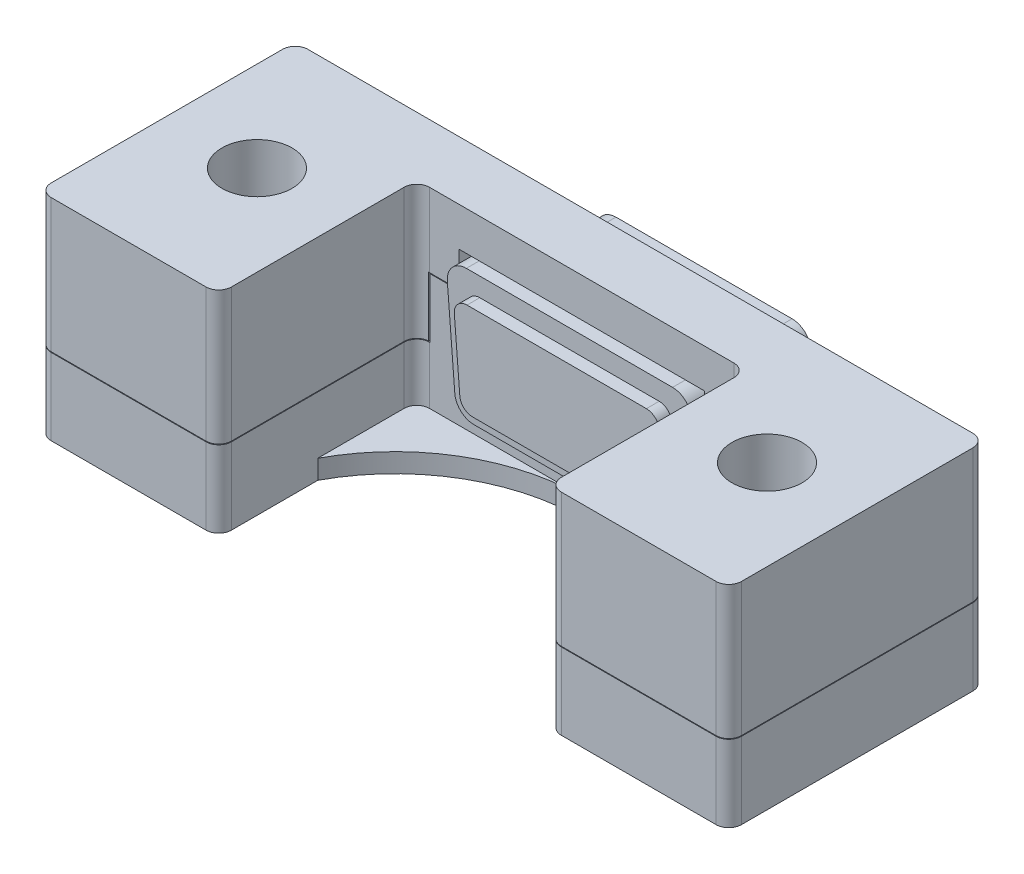
from build123d import *

# Parameters (mm, degrees)
SKETCH1_W               = 30.87
SKETCH1_H               = 12.52
SKETCH1_R               = 1.5
BOSS_EXTRUDE1_DEPTH     = 0.64
BOSS_EXTRUDE2_DEPTH     = 6
BOSS_EXTRUDE3_DEPTH     = 3.91
BOSS_EXTRUDE4_DEPTH     = 1
CUT_EXTRUDE1_DEPTH      = 0.1
BOSS_EXTRUDE5_START     = 0.01
SKETCH5_W               = 34.87
SKETCH5_H               = 16.52
BOSS_EXTRUDE5_DEPTH     = 1
SKETCH6_W               = 34.87
SKETCH6_H               = 16.52
SKETCH6_W_2             = 30.97
SKETCH6_H_2             = 12.62
BOSS_EXTRUDE6_DEPTH     = 1.1
SKETCH7_R               = 1.920228868
SKETCH7_R_2             = 1.5
SKETCH7_R_3             = 1.801647022
BOSS_EXTRUDE7_DEPTH     = 0.44
BOSS_EXTRUDE8_START     = 0.45
SKETCH8_W               = 34.87
SKETCH8_H               = 16.52
SKETCH8_W_2             = 19.27
SKETCH8_H_2             = 10.42
BOSS_EXTRUDE8_DEPTH     = 2.5
SKETCH9_R               = 2.067
BOSS_EXTRUDE10_DEPTH    = 16.52
FILLET1_R               = 1
BOSS_EXTRUDE11_DEPTH    = 1.5
CUT_EXTRUDE2_DEPTH      = 50.220202763
CUT_EXTRUDE2_DEPTH_BACK = 50.220202763
SKETCH11_W              = 7.833
SKETCH11_H              = 0.05
CUT_EXTRUDE3_DEPTH      = 50.447525519
CUT_EXTRUDE3_DEPTH_BACK = 50.447525519
SKETCH12_R              = 2.75
CUT_EXTRUDE4_DEPTH      = 5
CUT_EXTRUDE4_DEPTH_BACK = 50.447525519
CUT_EXTRUDE4_START      = -16.52
SKETCH12_2_R            = 2.75
THREAD1_PITCH           = 0.8
THREAD2_PITCH           = 0.8


with BuildPart() as part:
    # Sketch1 → Boss-Extrude1 (new body)
    # profile 1 of 2: a face of its own
    with BuildSketch(Plane.XY):
        with Locations((15.435, 6.26)):
            Rectangle(SKETCH1_W, SKETCH1_H)
        with Locations(Location((2.92, 6.26, 0), (0, 0, 180))):
            Circle(SKETCH1_R, mode=Mode.SUBTRACT)
        with Locations(Location((27.95, 6.26, 0), (0, 0, 180))):
            Circle(SKETCH1_R, mode=Mode.SUBTRACT)
        with BuildLine():
            ThreePointArc((23.82238222, 8.484029677), (23.478822582, 9.689511938), (22.34, 10.213252174))
            Line((22.34, 10.213252174), (8.53, 10.213252174))
            ThreePointArc((8.53, 10.213252174), (7.391177418, 9.689511938), (7.04761778, 8.484029677))
            Line((7.04761778, 8.484029677), (7.840875681, 3.354029677))
            ThreePointArc((7.840875681, 3.354029677), (8.346998137, 2.444429592), (9.323257901, 2.083252174))
            Line((9.323257901, 2.083252174), (21.546742099, 2.083252174))
            ThreePointArc((21.546742099, 2.083252174), (22.523001863, 2.444429592), (23.029124319, 3.354029677))
            Line((23.029124319, 3.354029677), (23.82238222, 8.484029677))
        make_face(mode=Mode.SUBTRACT)
    # profile 2 of 2: a face of its own
    with BuildSketch(Plane.XY):
        with BuildLine():
            Line((23.029124319, 3.354029677), (23.82238222, 8.484029677))
            ThreePointArc((23.82238222, 8.484029677), (23.478822582, 9.689511938), (22.34, 10.213252174))
            Line((22.34, 10.213252174), (8.53, 10.213252174))
            ThreePointArc((8.53, 10.213252174), (7.391177418, 9.689511938), (7.04761778, 8.484029677))
            Line((7.04761778, 8.484029677), (7.840875681, 3.354029677))
            ThreePointArc((7.840875681, 3.354029677), (8.346998137, 2.444429592), (9.323257901, 2.083252174))
            Line((9.323257901, 2.083252174), (21.546742099, 2.083252174))
            ThreePointArc((21.546742099, 2.083252174), (22.523001863, 2.444429592), (23.029124319, 3.354029677))
        make_face()
    extrude(amount=BOSS_EXTRUDE1_DEPTH)

    # Sketch1<3> → Boss-Extrude2 (add)
    with BuildSketch(Plane.XY):
        with BuildLine():
            Line((23.029124319, 3.354029677), (23.82238222, 8.484029677))
            ThreePointArc((23.82238222, 8.484029677), (23.478822582, 9.689511938), (22.34, 10.213252174))
            Line((22.34, 10.213252174), (8.53, 10.213252174))
            ThreePointArc((8.53, 10.213252174), (7.391177418, 9.689511938), (7.04761778, 8.484029677))
            Line((7.04761778, 8.484029677), (7.840875681, 3.354029677))
            ThreePointArc((7.840875681, 3.354029677), (8.346998137, 2.444429592), (9.323257901, 2.083252174))
            Line((9.323257901, 2.083252174), (21.546742099, 2.083252174))
            ThreePointArc((21.546742099, 2.083252174), (22.523001863, 2.444429592), (23.029124319, 3.354029677))
        make_face()
    extrude(amount=-BOSS_EXTRUDE2_DEPTH)

    # Sketch2 → Boss-Extrude3 (add)
    with BuildSketch(Plane.XY.offset(0.64)):
        with BuildLine():
            Line((22.933471556, 1.1), (7.936528444, 1.1))
            ThreePointArc((7.936528444, 1.1), (6.91910754, 1.497795525), (6.441320613, 2.480193726))
            Line((6.441320613, 2.480193726), (5.854792169, 9.800193726))
            ThreePointArc((5.854792169, 9.800193726), (6.247795525, 10.937420903), (7.35, 11.42))
            Line((7.35, 11.42), (23.52, 11.42))
            ThreePointArc((23.52, 11.42), (24.622204475, 10.937420903), (25.015207831, 9.800193726))
            Line((25.015207831, 9.800193726), (24.428679387, 2.480193726))
            ThreePointArc((24.428679387, 2.480193726), (23.95089246, 1.497795525), (22.933471556, 1.1))
        make_face()
    extrude(amount=BOSS_EXTRUDE3_DEPTH)

    # Sketch3 → Boss-Extrude4 (add)
    with BuildSketch(Plane.XY.offset(4.55)):
        with BuildLine():
            Line((8.831914281, 2.57), (22.038085719, 2.57))
            ThreePointArc((22.038085719, 2.57), (22.716366322, 2.835197017), (23.03489094, 3.490129151))
            Line((23.03489094, 3.490129151), (23.465973321, 8.870129151))
            ThreePointArc((23.465973321, 8.870129151), (23.203971084, 9.628280602), (22.4691681, 9.95))
            Line((22.4691681, 9.95), (8.4008319, 9.95))
            ThreePointArc((8.4008319, 9.95), (7.666028916, 9.628280602), (7.404026679, 8.870129151))
            Line((7.404026679, 8.870129151), (7.83510906, 3.490129151))
            ThreePointArc((7.83510906, 3.490129151), (8.153633678, 2.835197017), (8.831914281, 2.57))
        make_face()
    extrude(amount=BOSS_EXTRUDE4_DEPTH)

    # Sketch4 → Cut-Extrude1 (cut)
    with BuildSketch(Plane(origin=(0, 0, -6), x_dir=(-1, 0, 0), z_dir=(0, 0, -1))):
        with BuildLine():
            Line((-21.546742099, 2.283252174), (-9.323257901, 2.283252174))
            ThreePointArc((-9.323257901, 2.283252174), (-8.477166105, 2.596272603), (-8.038526644, 3.384592677))
            Line((-8.038526644, 3.384592677), (-7.245268742, 8.514592677))
            ThreePointArc((-7.245268742, 8.514592677), (-7.543020429, 9.55934397), (-8.53, 10.013252174))
            Line((-8.53, 10.013252174), (-22.34, 10.013252174))
            ThreePointArc((-22.34, 10.013252174), (-23.326979571, 9.55934397), (-23.624731258, 8.514592677))
            Line((-23.624731258, 8.514592677), (-22.831473356, 3.384592677))
            ThreePointArc((-22.831473356, 3.384592677), (-22.392833895, 2.596272603), (-21.546742099, 2.283252174))
        make_face()
    extrude(amount=-CUT_EXTRUDE1_DEPTH, mode=Mode.SUBTRACT)

    # Sketch7 → Boss-Extrude7 (add)
    # profile 1 of 2: a face of its own
    with BuildSketch(Plane.XY.offset(0.64)):
        with Locations((2.92, 6.26)):
            Circle(SKETCH7_R)
        with Locations(Location((2.92, 6.26, 0), (0, 0, 180))):
            Circle(SKETCH7_R_2, mode=Mode.SUBTRACT)
    # profile 2 of 2: a face of its own
    with BuildSketch(Plane.XY.offset(0.64)):
        with Locations((27.95, 6.26)):
            Circle(SKETCH7_R_3)
        with Locations(Location((27.95, 6.26, 0), (0, 0, 180))):
            Circle(SKETCH7_R_2, mode=Mode.SUBTRACT)
    extrude(amount=BOSS_EXTRUDE7_DEPTH)


with BuildPart() as body_2:
    # Sketch5 → Boss-Extrude5 (new body)
    with BuildSketch(Plane(origin=(0, 0, 0), x_dir=(-1, 0, 0), z_dir=(0, 0, -1)).offset(BOSS_EXTRUDE5_START)):
        with Locations((-15.435, 6.26)):
            Rectangle(SKETCH5_W, SKETCH5_H)
        with BuildLine():
            Line((-21.546742099, 1.083252174), (-9.323257901, 1.083252174))
            ThreePointArc((-9.323257901, 1.083252174), (-7.696158294, 1.685214538), (-6.852620867, 3.201214679))
            Line((-6.852620867, 3.201214679), (-6.059362966, 8.331214679))
            ThreePointArc((-6.059362966, 8.331214679), (-6.631962364, 10.340351781), (-8.53, 11.213252174))
            Line((-8.53, 11.213252174), (-22.34, 11.213252174))
            ThreePointArc((-22.34, 11.213252174), (-24.238037636, 10.340351781), (-24.810637034, 8.331214679))
            Line((-24.810637034, 8.331214679), (-24.017379133, 3.201214679))
            ThreePointArc((-24.017379133, 3.201214679), (-23.173841706, 1.685214538), (-21.546742099, 1.083252174))
        make_face(mode=Mode.SUBTRACT)
    extrude(amount=BOSS_EXTRUDE5_DEPTH)

    # Sketch6 → Boss-Extrude6 (add)
    with BuildSketch(Plane.XY.offset(-0.01)):
        with Locations((15.435, 6.26)):
            Rectangle(SKETCH6_W, SKETCH6_H)
        with Locations((15.435, 6.26)):
            Rectangle(SKETCH6_W_2, SKETCH6_H_2, mode=Mode.SUBTRACT)
    extrude(amount=BOSS_EXTRUDE6_DEPTH)

    # Sketch8 → Boss-Extrude8 (add)
    with BuildSketch(Plane.XY.offset(0.64).offset(BOSS_EXTRUDE8_START)):
        with Locations((15.435, 6.26)):
            Rectangle(SKETCH8_W, SKETCH8_H)
        with Locations((15.435, 6.26)):
            Rectangle(SKETCH8_W_2, SKETCH8_H_2, mode=Mode.SUBTRACT)
    extrude(amount=BOSS_EXTRUDE8_DEPTH)

    # Sketch9 → Boss-Extrude10 (add)
    # profile 1 of 2: a face of its own
    with BuildSketch(Plane.XZ.offset(2)):
        Polygon((32.87, -1.01), (42.502, -1.01), (42.502, 19.124), (28.368, 19.124), (28.368, 3.59), (32.87, 3.59), align=None)
        with Locations((35.435, 9.057)):
            Circle(SKETCH9_R, mode=Mode.SUBTRACT)
    # profile 2 of 2: a face of its own
    with BuildSketch(Plane.XZ.offset(2)):
        Polygon((-11.632, 19.124), (-11.632, -1.01), (-2, -1.01), (-2, 3.59), (2.502, 3.59), (2.502, 19.124), align=None)
        with Locations((-4.565, 9.057)):
            Circle(SKETCH9_R, mode=Mode.SUBTRACT)
    extrude(amount=-BOSS_EXTRUDE10_DEPTH)

    # Fillet1
    fillet1_edges = [body_2.edges().sort_by_distance(p)[0] for p in [
        (28.368, 6.26, 19.124),
        (28.368, 6.26, 3.59),
        (42.502, 6.26, -1.01),
        (42.502, 6.26, 19.124),
        (-11.632, 6.26, -1.01),
        (2.502, 6.26, 3.59),
        (2.502, 6.26, 19.124),
        (-11.632, 6.26, 19.124),
    ]]
    fillet(fillet1_edges, radius=FILLET1_R)

    # Sketch10 → Boss-Extrude11 (add)
    with BuildSketch(Plane.XZ.offset(2)):
        with BuildLine():
            Line((3.502, 3.59), (15.434999958, 3.59))
            ThreePointArc((15.434999958, 3.59), (7.89197708, 5.6809584), (2.502, 11.357))
            Line((2.502, 11.357), (2.502, 4.59))
            ThreePointArc((2.502, 4.59), (2.794893219, 3.882893219), (3.502, 3.59))
        make_face()
        with BuildLine():
            Line((15.434999958, 3.59), (27.368, 3.59))
            ThreePointArc((27.368, 3.59), (28.075106781, 3.882893219), (28.368, 4.59))
            Line((28.368, 4.59), (28.368, 11.357))
            ThreePointArc((28.368, 11.357), (22.978022884, 5.680958378), (15.434999958, 3.59))
        make_face()
    extrude(amount=-BOSS_EXTRUDE11_DEPTH)

    # Sketch11 → Cut-Extrude2 (cut, two sides: drawn at the far end of the back side and taken through both)
    with BuildSketch(Plane(origin=(0, 0, -1.01), x_dir=(-1, 0, 0), z_dir=(0, 0, -1)).offset(-CUT_EXTRUDE2_DEPTH_BACK)):
        with BuildLine():
            Line((-24.839990893, 8.72), (-27.435, 8.72))
            Line((-27.435, 8.72), (-27.435, 8.67))
            Line((-27.435, 8.67), (-27.435, 4.05))
            Line((-27.435, 4.05), (-41.502, 4.05))
            Line((-41.502, 4.05), (-41.502, 4))
            Line((-41.502, 4), (-27.335, 4))
            Line((-27.335, 4), (-27.335, 8.67))
            Line((-27.335, 8.67), (-24.839625822, 8.67))
            ThreePointArc((-24.839625822, 8.67), (-24.839933364, 8.694999087), (-24.839990893, 8.72))
        make_face()
        with BuildLine():
            Line((-3.435, 8.72), (-6.030009107, 8.72))
            ThreePointArc((-6.030009107, 8.72), (-6.030066636, 8.694999087), (-6.030374178, 8.67))
            Line((-6.030374178, 8.67), (-3.535, 8.67))
            Line((-3.535, 8.67), (-3.535, 4))
            Line((-3.535, 4), (10.632, 4))
            Line((10.632, 4), (10.632, 4.05))
            Line((10.632, 4.05), (-3.435, 4.05))
            Line((-3.435, 4.05), (-3.435, 8.67))
            Line((-3.435, 8.67), (-3.435, 8.72))
        make_face()
        with Locations((14.5485, 4.025)):
            Rectangle(SKETCH11_W, SKETCH11_H)
        with Locations((-45.4185, 4.025)):
            Rectangle(SKETCH11_W, SKETCH11_H)
    extrude(amount=CUT_EXTRUDE2_DEPTH + CUT_EXTRUDE2_DEPTH_BACK, mode=Mode.SUBTRACT)


with BuildPart() as cut_extrude2_piece_1:
    # of the separate pieces the step leaves, piece 1, a body of its own (cut_extrude2_pieces)
    add(body_2.part.solids().sort_by_distance((3.435, 4.05, -1.01))[0])

    # Sketch12<2> → Cut-Extrude4 (cut, two sides: drawn at the far end of the back side and taken through both)
    with BuildSketch(Plane.XZ.offset(2).offset(CUT_EXTRUDE4_START - CUT_EXTRUDE4_DEPTH_BACK)):
        with Locations((-4.565, 9.057)):
            Circle(SKETCH12_2_R)
        with Locations(Location((35.435, 9.057, 0), (0, 0, 180))):
            Circle(SKETCH12_2_R)
    extrude(amount=CUT_EXTRUDE4_DEPTH + CUT_EXTRUDE4_DEPTH_BACK, mode=Mode.SUBTRACT)

    # Thread1: the profile of Thread Profile2 profile screwed along a right-hand helix of 8.75 turns, 8 arcs to a turn; built about Z, then put on its axis
    thread1_z = Axis((0, 0, 0), (0, 0, 1))
    thread1_corners = [(2.0667, 0, -0.000173205), (2.5000127, 0, 0.249999999), (2.5000127, 0, 0.349999999), (2.0667, 0, 0.600173203)]
    with BuildLine(mode=Mode.PRIVATE) as thread1_profile:
        Line(thread1_corners[0], thread1_corners[1])
        Line(thread1_corners[1], thread1_corners[2])
        Line(thread1_corners[2], thread1_corners[3])
        Line(thread1_corners[3], thread1_corners[0])
    thread1_cap = Face(thread1_profile.wire())
    thread1_turn_angles = [0, 22.5, 45, 67.5, 90, 112.5, 135, 157.5, 180, 202.5, 225, 247.5, 270, 292.5, 315, 337.5, 360]
    thread1_turn_weights = [1, 0.9238795325112867, 1, 0.9238795325112867, 1, 0.9238795325112867, 1, 0.9238795325112867, 1, 0.9238795325112867, 1, 0.9238795325112867, 1, 0.9238795325112867, 1, 0.9238795325112867, 1]
    thread1_turn_rails = [Edge.make_bspline([Vector(p[0], p[1], 0).rotate(thread1_z, thread1_turn_angles[k]) / thread1_turn_weights[k] + Vector(0, 0, p[2] + THREAD1_PITCH * thread1_turn_angles[k] / 360) for k in range(17)], [0, 0, 0, 1, 1, 2, 2, 3, 3, 4, 4, 5, 5, 6, 6, 7, 7, 8, 8, 8], 2, thread1_turn_weights) for p in thread1_corners]
    thread1_turn_sides = [Face.make_surface_from_curves(thread1_turn_rails[p[0]], thread1_turn_rails[p[1]]) for p in [(0, 1), (1, 2), (2, 3), (3, 0)]]
    thread1_last_angles = [2880, 2902.5, 2925, 2947.5, 2970, 2992.5, 3015, 3037.5, 3060, 3082.5, 3105, 3127.5, 3150]
    thread1_last_weights = [1, 0.9238795325112867, 1, 0.9238795325112867, 1, 0.9238795325112867, 1, 0.9238795325112867, 1, 0.9238795325112867, 1, 0.9238795325112867, 1]
    thread1_last_rails = [Edge.make_bspline([Vector(p[0], p[1], 0).rotate(thread1_z, thread1_last_angles[k]) / thread1_last_weights[k] + Vector(0, 0, p[2] + THREAD1_PITCH * thread1_last_angles[k] / 360) for k in range(13)], [0, 0, 0, 1, 1, 2, 2, 3, 3, 4, 4, 5, 5, 6, 6, 6], 2, thread1_last_weights) for p in thread1_corners]
    thread1_last_sides = [Face.make_surface_from_curves(thread1_last_rails[p[0]], thread1_last_rails[p[1]]) for p in [(0, 1), (1, 2), (2, 3), (3, 0)]]
    thread1 = Plane(origin=(35.435, 10.52, 9.057), x_dir=(-1, 0, 0), z_dir=(0, -1, 0)) * Solid(Shell([*[p.moved(Location((0, 0, THREAD1_PITCH * i))) for i in range(8) for p in thread1_turn_sides], *thread1_last_sides, thread1_cap, thread1_cap.rotate(thread1_z, 3150).moved(Location((0, 0, THREAD1_PITCH * 3150 / 360)))]))
    add(thread1, mode=Mode.SUBTRACT)

    # Thread2: the profile of Thread Profile3 profile screwed along a right-hand helix of 8.75 turns, 8 arcs to a turn; built about Z, then put on its axis
    thread2_z = Axis((0, 0, 0), (0, 0, 1))
    thread2_corners = [(2.0667, 0, -0.000173205), (2.5000127, 0, 0.249999999), (2.5000127, 0, 0.349999999), (2.0667, 0, 0.600173203)]
    with BuildLine(mode=Mode.PRIVATE) as thread2_profile:
        Line(thread2_corners[0], thread2_corners[1])
        Line(thread2_corners[1], thread2_corners[2])
        Line(thread2_corners[2], thread2_corners[3])
        Line(thread2_corners[3], thread2_corners[0])
    thread2_cap = Face(thread2_profile.wire())
    thread2_turn_angles = [0, 22.5, 45, 67.5, 90, 112.5, 135, 157.5, 180, 202.5, 225, 247.5, 270, 292.5, 315, 337.5, 360]
    thread2_turn_weights = [1, 0.9238795325112867, 1, 0.9238795325112867, 1, 0.9238795325112867, 1, 0.9238795325112867, 1, 0.9238795325112867, 1, 0.9238795325112867, 1, 0.9238795325112867, 1, 0.9238795325112867, 1]
    thread2_turn_rails = [Edge.make_bspline([Vector(p[0], p[1], 0).rotate(thread2_z, thread2_turn_angles[k]) / thread2_turn_weights[k] + Vector(0, 0, p[2] + THREAD2_PITCH * thread2_turn_angles[k] / 360) for k in range(17)], [0, 0, 0, 1, 1, 2, 2, 3, 3, 4, 4, 5, 5, 6, 6, 7, 7, 8, 8, 8], 2, thread2_turn_weights) for p in thread2_corners]
    thread2_turn_sides = [Face.make_surface_from_curves(thread2_turn_rails[p[0]], thread2_turn_rails[p[1]]) for p in [(0, 1), (1, 2), (2, 3), (3, 0)]]
    thread2_last_angles = [2880, 2902.5, 2925, 2947.5, 2970, 2992.5, 3015, 3037.5, 3060, 3082.5, 3105, 3127.5, 3150]
    thread2_last_weights = [1, 0.9238795325112867, 1, 0.9238795325112867, 1, 0.9238795325112867, 1, 0.9238795325112867, 1, 0.9238795325112867, 1, 0.9238795325112867, 1]
    thread2_last_rails = [Edge.make_bspline([Vector(p[0], p[1], 0).rotate(thread2_z, thread2_last_angles[k]) / thread2_last_weights[k] + Vector(0, 0, p[2] + THREAD2_PITCH * thread2_last_angles[k] / 360) for k in range(13)], [0, 0, 0, 1, 1, 2, 2, 3, 3, 4, 4, 5, 5, 6, 6, 6], 2, thread2_last_weights) for p in thread2_corners]
    thread2_last_sides = [Face.make_surface_from_curves(thread2_last_rails[p[0]], thread2_last_rails[p[1]]) for p in [(0, 1), (1, 2), (2, 3), (3, 0)]]
    thread2 = Plane(origin=(-4.565, 10.52, 9.057), x_dir=(-1, 0, 0), z_dir=(0, -1, 0)) * Solid(Shell([*[p.moved(Location((0, 0, THREAD2_PITCH * i))) for i in range(8) for p in thread2_turn_sides], *thread2_last_sides, thread2_cap, thread2_cap.rotate(thread2_z, 3150).moved(Location((0, 0, THREAD2_PITCH * 3150 / 360)))]))
    add(thread2, mode=Mode.SUBTRACT)


with BuildPart() as cut_extrude2_piece_2:
    # of the separate pieces the step leaves, piece 2, a body of its own (cut_extrude2_pieces)
    add(body_2.part.solids().sort_by_distance((-10.632, -2, -1.01))[0])

    # Sketch12 → Cut-Extrude3 (cut, two sides: drawn at the far end of the back side and taken through both)
    with BuildSketch(Plane.XZ.offset(2).offset(-CUT_EXTRUDE3_DEPTH_BACK)):
        with Locations((-4.565, 9.057)):
            Circle(SKETCH12_R)
        with Locations(Location((35.435, 9.057, 0), (0, 0, 180))):
            Circle(SKETCH12_R)
    extrude(amount=CUT_EXTRUDE3_DEPTH + CUT_EXTRUDE3_DEPTH_BACK, mode=Mode.SUBTRACT)


solid = Compound([part.part, cut_extrude2_piece_1.part, cut_extrude2_piece_2.part])
